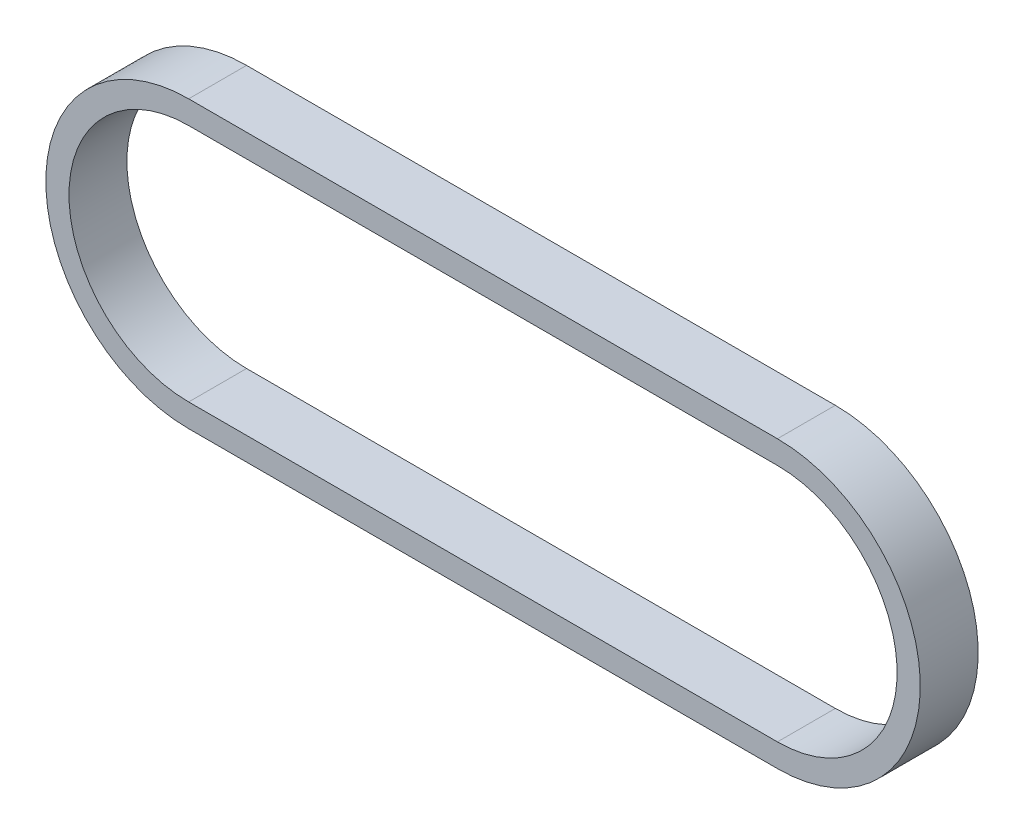
from build123d import *

# Parameters (mm, degrees)
BOSS_EXTRU_1_DEPTH = 6


with BuildPart() as part:
    # Esquisse1 → Boss.-Extru.1 (new body)
    with BuildSketch(Plane.XY):
        with BuildLine():
            Line((0, 14.8), (61, 14.8))
            ThreePointArc((61, 14.8), (75.8, 0), (61, -14.8))
            Line((61, -14.8), (0, -14.8))
            ThreePointArc((0, -14.8), (-14.8, 0), (0, 14.8))
        make_face()
        with BuildLine():
            Line((0, 12.4), (61, 12.4))
            ThreePointArc((61, 12.4), (73.4, 0), (61, -12.4))
            Line((61, -12.4), (0, -12.4))
            ThreePointArc((0, -12.4), (-12.4, 0), (0, 12.4))
        make_face(mode=Mode.SUBTRACT)
    extrude(amount=BOSS_EXTRU_1_DEPTH)


solid = part.part
